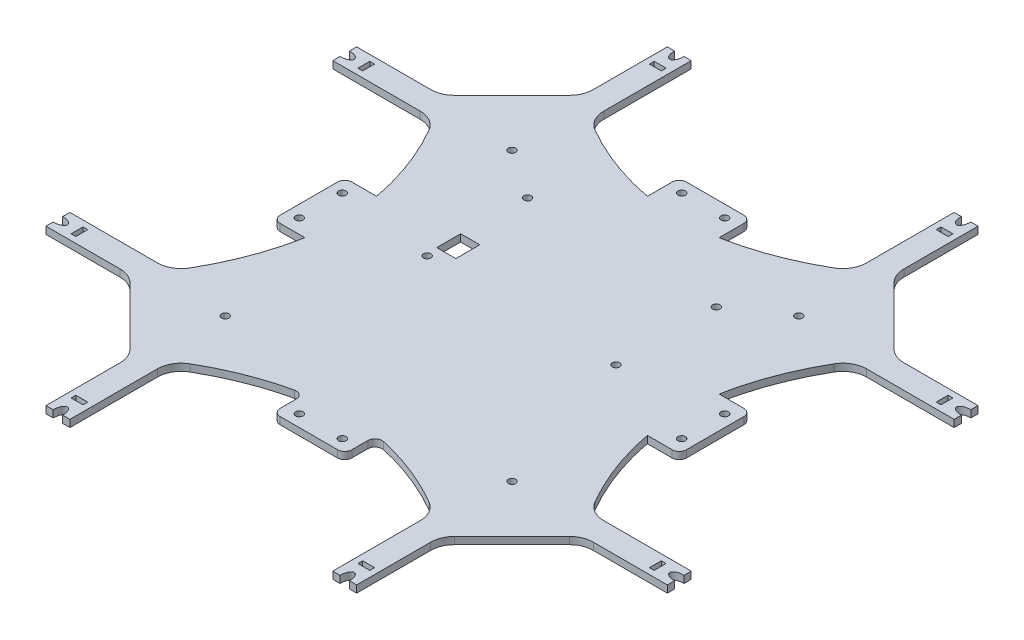
from build123d import *

# Parameters (mm, degrees)
SKETCH_1_R                   = 5
SKETCH_1_R_2                 = 1.55
EXTRUDE_1_DEPTH              = 3
SKETCH_2_R                   = 1.55
CUT_EXTRUDE_1_DEPTH          = 156.592416411
SKETCH_3_R                   = 1.55
CUT_EXTRUDE_2_DEPTH          = 156.592416411
SKETCH_4_W                   = 30
SKETCH_4_H                   = 30
SKETCH_4_R                   = 1.55
EXTRUDE_2_DEPTH              = 3
FILLET_1_R                   = 3
SKETCH_5_W                   = 2
SKETCH_5_H                   = 5
SKETCH_5_W_2                 = 5
SKETCH_5_H_2                 = 2
EXTRUDE_3_DEPTH              = 3
CUT_EXTRUDE_START            = -3
CUT_EXTRUDE_3_DEPTH          = 3
FILLET_4_R                   = 10
PATTERN_CIRCULAR_1_OUTLINE_R = 1.55
PATTERN_CIRCULAR_1_DEPTH     = 3
SKETCH_9_W                   = 8
SKETCH_9_H                   = 10
CUT_EXTRUDE_4_DEPTH          = 10


# Read off the part's stored shape, not the designer's step: 環狀複製排列1
with BuildPart() as part:
    # 草圖1 → 填料-伸長1 (new body)
    with BuildSketch(Plane(origin=(0, 0, 0), x_dir=(1, 0, 0), z_dir=(0, 1, 0))):
        with BuildLine():
            ThreePointArc((-75.988340656, 104.271419075), (-104.142135624, 104.142135624), (-104.271419075, 75.988340656))
            add(Edge.make_bspline(
                [(-104.271419075, 75.988340656), (-71.712668089, 41.311256225), (-70, 0)],
                knots=[0, 0, 0, 0.900052689, 0.900052689, 0.900052689], degree=2))
            add(Edge.make_bspline(
                [(-104.271419075, -75.988340656), (-71.712668089, -41.311256225), (-70, 0)],
                knots=[0, 0, 0, 0.900052689, 0.900052689, 0.900052689], degree=2))
            ThreePointArc((-104.271419075, -75.988340656), (-104.142135624, -104.142135624), (-75.988340656, -104.271419075))
            add(Edge.make_bspline(
                [(-75.988340656, -104.271419075), (-41.311256225, -71.712668089), (0, -70)],
                knots=[0, 0, 0, 0.900052689, 0.900052689, 0.900052689], degree=2))
            add(Edge.make_bspline(
                [(75.988340656, -104.271419075), (41.311256225, -71.712668089), (0, -70)],
                knots=[0, 0, 0, 0.900052689, 0.900052689, 0.900052689], degree=2))
            ThreePointArc((75.988340656, -104.271419075), (104.142135624, -104.142135624), (104.271419075, -75.988340656))
            add(Edge.make_bspline(
                [(104.271419075, -75.988340656), (71.712668089, -41.311256225), (70, 0)],
                knots=[0, 0, 0, 0.900052689, 0.900052689, 0.900052689], degree=2))
            add(Edge.make_bspline(
                [(104.271419075, 75.988340656), (71.712668089, 41.311256225), (70, 0)],
                knots=[0, 0, 0, 0.900052689, 0.900052689, 0.900052689], degree=2))
            ThreePointArc((104.271419075, 75.988340656), (104.142135624, 104.142135624), (75.988340656, 104.271419075))
            add(Edge.make_bspline(
                [(75.988340656, 104.271419075), (41.311256225, 71.712668089), (0, 70)],
                knots=[0, 0, 0, 0.900052689, 0.900052689, 0.900052689], degree=2))
            add(Edge.make_bspline(
                [(-75.988340656, 104.271419075), (-41.311256225, 71.712668089), (0, 70)],
                knots=[0, 0, 0, 0.900052689, 0.900052689, 0.900052689], degree=2))
        make_face()
        with Locations(Location((-90, 90, 0), (0, 0, 270))):
            Circle(SKETCH_1_R, mode=Mode.SUBTRACT)
        with Locations(Location((90, 90, 0), (0, 0, 270))):
            Circle(SKETCH_1_R, mode=Mode.SUBTRACT)
        with Locations(Location((90, -90, 0), (0, 0, 270))):
            Circle(SKETCH_1_R, mode=Mode.SUBTRACT)
        with Locations(Location((-90, -90, 0), (0, 0, 270))):
            Circle(SKETCH_1_R, mode=Mode.SUBTRACT)
        with Locations(Location((-90, 98, 0), (0, 0, 270))):
            Circle(SKETCH_1_R_2, mode=Mode.SUBTRACT)
        with Locations(Location((-99.5, 90, 0), (0, 0, 270))):
            Circle(SKETCH_1_R_2, mode=Mode.SUBTRACT)
        with Locations(Location((-90, 82, 0), (0, 0, 270))):
            Circle(SKETCH_1_R_2, mode=Mode.SUBTRACT)
        with Locations(Location((-80.5, 90, 0), (0, 0, 270))):
            Circle(SKETCH_1_R_2, mode=Mode.SUBTRACT)
        with Locations(Location((90, 98, 0), (0, 0, 270))):
            Circle(SKETCH_1_R_2, mode=Mode.SUBTRACT)
        with Locations(Location((90, 82, 0), (0, 0, 270))):
            Circle(SKETCH_1_R_2, mode=Mode.SUBTRACT)
        with Locations(Location((80.5, 90, 0), (0, 0, 270))):
            Circle(SKETCH_1_R_2, mode=Mode.SUBTRACT)
        with Locations(Location((99.5, 90, 0), (0, 0, 270))):
            Circle(SKETCH_1_R_2, mode=Mode.SUBTRACT)
        with Locations(Location((80.5, -90, 0), (0, 0, 270))):
            Circle(SKETCH_1_R_2, mode=Mode.SUBTRACT)
        with Locations(Location((90, -82, 0), (0, 0, 270))):
            Circle(SKETCH_1_R_2, mode=Mode.SUBTRACT)
        with Locations(Location((99.5, -90, 0), (0, 0, 270))):
            Circle(SKETCH_1_R_2, mode=Mode.SUBTRACT)
        with Locations(Location((90, -98, 0), (0, 0, 270))):
            Circle(SKETCH_1_R_2, mode=Mode.SUBTRACT)
        with Locations(Location((-90, -82, 0), (0, 0, 270))):
            Circle(SKETCH_1_R_2, mode=Mode.SUBTRACT)
        with Locations(Location((-80.5, -90, 0), (0, 0, 270))):
            Circle(SKETCH_1_R_2, mode=Mode.SUBTRACT)
        with Locations(Location((-90, -98, 0), (0, 0, 270))):
            Circle(SKETCH_1_R_2, mode=Mode.SUBTRACT)
        with Locations(Location((-99.5, -90, 0), (0, 0, 270))):
            Circle(SKETCH_1_R_2, mode=Mode.SUBTRACT)
    extrude(amount=EXTRUDE_1_DEPTH)

    # 草圖2 → 除料-伸長1 (cut, through all)
    with BuildSketch(Plane(origin=(0, 3, 0), x_dir=(1, 0, 0), z_dir=(0, 1, 0))):
        with Locations(Location((-60, 60, 0), (0, 0, 270))):
            Circle(SKETCH_2_R)
        with Locations(Location((60, 60, 0), (0, 0, 270))):
            Circle(SKETCH_2_R)
        with Locations(Location((60, -60, 0), (0, 0, 270))):
            Circle(SKETCH_2_R)
        with Locations(Location((-60, -60, 0), (0, 0, 270))):
            Circle(SKETCH_2_R)
    extrude(amount=-CUT_EXTRUDE_1_DEPTH, mode=Mode.SUBTRACT)

    # 草圖3 → 除料-伸長2 (cut, through all)
    with BuildSketch(Plane(origin=(0, 3, 0), x_dir=(1, 0, 0), z_dir=(0, 1, 0))):
        with Locations(Location((-39.5, 46, 0), (0, 0, 270))):
            Circle(SKETCH_3_R)
        with Locations(Location((39.5, 46, 0), (0, 0, 270))):
            Circle(SKETCH_3_R)
        with Locations(Location((39.5, 4, 0), (0, 0, 270))):
            Circle(SKETCH_3_R)
        with Locations(Location((-39.5, 4, 0), (0, 0, 270))):
            Circle(SKETCH_3_R)
    extrude(amount=-CUT_EXTRUDE_2_DEPTH, mode=Mode.SUBTRACT)

    # 草圖4 → 填料-伸長2 (add)
    with BuildSketch(Plane(origin=(0, 3, 0), x_dir=(1, 0, 0), z_dir=(0, 1, 0))):
        with Locations((0, -70)):
            Rectangle(SKETCH_4_W, SKETCH_4_H)
        with Locations(Location((-9, -80, 0), (0, 0, 270))):
            Circle(SKETCH_4_R, mode=Mode.SUBTRACT)
        with Locations(Location((9, -80, 0), (0, 0, 90))):
            Circle(SKETCH_4_R, mode=Mode.SUBTRACT)
    extrude(amount=-EXTRUDE_2_DEPTH)

    # 圓角1
    fillet_1_edges = [part.edges().sort_by_distance(p)[0] for p in [
        (-15, 1.5, 85),
        (15, 1.5, 71.678655516),
        (15, 1.5, 85),
        (-15, 1.5, 71.678655516),
    ]]
    fillet(fillet_1_edges, radius=FILLET_1_R)

    # 草圖5 → 填料-伸長3 (add)
    # profile 1 of 8: a face of its own
    with BuildSketch(Plane(origin=(0, 3, 0), x_dir=(1, 0, 0), z_dir=(0, 1, 0))):
        with BuildLine():
            Line((-130, 62), (-130, 65))
            Line((-130, 65), (-94.857822627, 65))
            add(Edge.make_bspline(
                [(-94.857822627, 65), (-91.022806975, 60.063382547), (-87.777195204, 55)],
                knots=[0, 0, 0, 1, 1, 1], degree=2))
            Line((-87.777195204, 55), (-130, 55))
            Line((-130, 55), (-130, 58))
            add(Edge.make_bspline(
                [(-130, 58), (-126, 58), (-126, 60), (-126, 62), (-130, 62)],
                knots=[4.71238898, 4.71238898, 4.71238898, 6.283185307, 6.283185307, 7.853981634, 7.853981634, 7.853981634], degree=2, weights=[1, 0.707106781, 1, 0.707106781, 1]))
        make_face()
        with Locations((-121, 60)):
            Rectangle(SKETCH_5_W, SKETCH_5_H, mode=Mode.SUBTRACT)
    # profile 2 of 8: a face of its own
    with BuildSketch(Plane(origin=(0, 3, 0), x_dir=(1, 0, 0), z_dir=(0, 1, 0))):
        with BuildLine():
            Line((-58, 130), (-55, 130))
            Line((-55, 130), (-55, 87.777195204))
            add(Edge.make_bspline(
                [(-65, 94.857822627), (-60.063382547, 91.022806975), (-55, 87.777195204)],
                knots=[0, 0, 0, 1, 1, 1], degree=2))
            Line((-65, 94.857822627), (-65, 130))
            Line((-65, 130), (-62, 130))
            add(Edge.make_bspline(
                [(-62, 130), (-62, 126), (-60, 126), (-58, 126), (-58, 130)],
                knots=[4.71238898, 4.71238898, 4.71238898, 6.283185307, 6.283185307, 7.853981634, 7.853981634, 7.853981634], degree=2, weights=[1, 0.707106781, 1, 0.707106781, 1]))
        make_face()
        with Locations((-60, 121)):
            Rectangle(SKETCH_5_W_2, SKETCH_5_H_2, mode=Mode.SUBTRACT)
    # profile 3 of 8: a face of its own
    with BuildSketch(Plane(origin=(0, 3, 0), x_dir=(1, 0, 0), z_dir=(0, 1, 0))):
        with BuildLine():
            Line((55, 130), (55, 87.777195204))
            add(Edge.make_bspline(
                [(65, 94.857822627), (60.063382547, 91.022806975), (55, 87.777195204)],
                knots=[0, 0, 0, 1, 1, 1], degree=2))
            Line((65, 94.857822627), (65, 130))
            Line((65, 130), (62, 130))
            add(Edge.make_bspline(
                [(58, 130), (58, 126), (60, 126), (62, 126), (62, 130)],
                knots=[4.71238898, 4.71238898, 4.71238898, 6.283185307, 6.283185307, 7.853981634, 7.853981634, 7.853981634], degree=2, weights=[1, 0.707106781, 1, 0.707106781, 1]))
            Line((58, 130), (55, 130))
        make_face()
        with Locations((60, 121)):
            Rectangle(SKETCH_5_W_2, SKETCH_5_H_2, mode=Mode.SUBTRACT)
    # profile 4 of 8: a face of its own
    with BuildSketch(Plane(origin=(0, 3, 0), x_dir=(1, 0, 0), z_dir=(0, 1, 0))):
        with BuildLine():
            Line((130, 62), (130, 65))
            Line((130, 65), (94.857822627, 65))
            add(Edge.make_bspline(
                [(94.857822627, 65), (91.022806975, 60.063382547), (87.777195204, 55)],
                knots=[0, 0, 0, 1, 1, 1], degree=2))
            Line((87.777195204, 55), (130, 55))
            Line((130, 55), (130, 58))
            add(Edge.make_bspline(
                [(130, 62), (126, 62), (126, 60), (126, 58), (130, 58)],
                knots=[4.71238898, 4.71238898, 4.71238898, 6.283185307, 6.283185307, 7.853981634, 7.853981634, 7.853981634], degree=2, weights=[1, 0.707106781, 1, 0.707106781, 1]))
        make_face()
        with Locations((121, 60)):
            Rectangle(SKETCH_5_W, SKETCH_5_H, mode=Mode.SUBTRACT)
    # profile 5 of 8: a face of its own
    with BuildSketch(Plane(origin=(0, 3, 0), x_dir=(1, 0, 0), z_dir=(0, 1, 0))):
        with BuildLine():
            Line((130, -65), (94.857822627, -65))
            add(Edge.make_bspline(
                [(94.857822627, -65), (91.022806975, -60.063382547), (87.777195204, -55)],
                knots=[0, 0, 0, 1, 1, 1], degree=2))
            Line((87.777195204, -55), (130, -55))
            Line((130, -55), (130, -58))
            add(Edge.make_bspline(
                [(130, -58), (126, -58), (126, -60), (126, -62), (130, -62)],
                knots=[4.71238898, 4.71238898, 4.71238898, 6.283185307, 6.283185307, 7.853981634, 7.853981634, 7.853981634], degree=2, weights=[1, 0.707106781, 1, 0.707106781, 1]))
            Line((130, -62), (130, -65))
        make_face()
        with Locations((121, -60)):
            Rectangle(SKETCH_5_W, SKETCH_5_H, mode=Mode.SUBTRACT)
    # profile 6 of 8: a face of its own
    with BuildSketch(Plane(origin=(0, 3, 0), x_dir=(1, 0, 0), z_dir=(0, 1, 0))):
        with BuildLine():
            Line((58, -130), (55, -130))
            Line((55, -130), (55, -87.777195204))
            add(Edge.make_bspline(
                [(65, -94.857822627), (60.063382547, -91.022806975), (55, -87.777195204)],
                knots=[0, 0, 0, 1, 1, 1], degree=2))
            Line((65, -94.857822627), (65, -130))
            Line((65, -130), (62, -130))
            add(Edge.make_bspline(
                [(62, -130), (62, -126), (60, -126), (58, -126), (58, -130)],
                knots=[4.71238898, 4.71238898, 4.71238898, 6.283185307, 6.283185307, 7.853981634, 7.853981634, 7.853981634], degree=2, weights=[1, 0.707106781, 1, 0.707106781, 1]))
        make_face()
        with Locations((60, -121)):
            Rectangle(SKETCH_5_W_2, SKETCH_5_H_2, mode=Mode.SUBTRACT)
    # profile 7 of 8: a face of its own
    with BuildSketch(Plane(origin=(0, 3, 0), x_dir=(1, 0, 0), z_dir=(0, 1, 0))):
        with BuildLine():
            Line((-55, -130), (-55, -87.777195204))
            add(Edge.make_bspline(
                [(-65, -94.857822627), (-60.063382547, -91.022806975), (-55, -87.777195204)],
                knots=[0, 0, 0, 1, 1, 1], degree=2))
            Line((-65, -94.857822627), (-65, -130))
            Line((-65, -130), (-62, -130))
            add(Edge.make_bspline(
                [(-58, -130), (-58, -126), (-60, -126), (-62, -126), (-62, -130)],
                knots=[4.71238898, 4.71238898, 4.71238898, 6.283185307, 6.283185307, 7.853981634, 7.853981634, 7.853981634], degree=2, weights=[1, 0.707106781, 1, 0.707106781, 1]))
            Line((-58, -130), (-55, -130))
        make_face()
        with Locations((-60, -121)):
            Rectangle(SKETCH_5_W_2, SKETCH_5_H_2, mode=Mode.SUBTRACT)
    # profile 8 of 8: a face of its own
    with BuildSketch(Plane(origin=(0, 3, 0), x_dir=(1, 0, 0), z_dir=(0, 1, 0))):
        with BuildLine():
            Line((-130, -62), (-130, -65))
            Line((-130, -65), (-94.857822627, -65))
            add(Edge.make_bspline(
                [(-94.857822627, -65), (-91.022806975, -60.063382547), (-87.777195204, -55)],
                knots=[0, 0, 0, 1, 1, 1], degree=2))
            Line((-87.777195204, -55), (-130, -55))
            Line((-130, -55), (-130, -58))
            add(Edge.make_bspline(
                [(-130, -62), (-126, -62), (-126, -60), (-126, -58), (-130, -58)],
                knots=[4.71238898, 4.71238898, 4.71238898, 6.283185307, 6.283185307, 7.853981634, 7.853981634, 7.853981634], degree=2, weights=[1, 0.707106781, 1, 0.707106781, 1]))
        make_face()
        with Locations((-121, -60)):
            Rectangle(SKETCH_5_W, SKETCH_5_H, mode=Mode.SUBTRACT)
    extrude(amount=-EXTRUDE_3_DEPTH)

    # 草圖6 → 除料-伸長3 (cut)
    with BuildSketch(Plane(origin=(0, 3, 0), x_dir=(1, 0, 0), z_dir=(0, 1, 0)).offset(CUT_EXTRUDE_START)):
        with BuildLine():
            Line((-94.857822627, 65), (-64.999999959, 94.857822595))
            add(Edge.make_bspline(
                [(-75.988340656, 104.271419075), (-70.575005667, 99.188770727), (-64.999999959, 94.857822595)],
                knots=[0, 0, 0, 1, 1, 1], degree=2))
            ThreePointArc((-75.988340656, 104.271419075), (-104.142135624, 104.142135624), (-104.271419075, 75.988340656))
            add(Edge.make_bspline(
                [(-104.271419075, 75.988340656), (-99.188770745, 70.575005686), (-94.857822627, 65)],
                knots=[0, 0, 0, 1, 1, 1], degree=2))
        make_face()
        with BuildLine():
            Line((65, 94.857822627), (94.857822627, 65))
            add(Edge.make_bspline(
                [(104.271419075, 75.988340656), (99.188770745, 70.575005686), (94.857822627, 65)],
                knots=[0, 0, 0, 1, 1, 1], degree=2))
            ThreePointArc((104.271419075, 75.988340656), (104.142135624, 104.142135624), (75.988340656, 104.271419075))
            add(Edge.make_bspline(
                [(75.988340656, 104.271419075), (70.575005686, 99.188770745), (65, 94.857822627)],
                knots=[0, 0, 0, 1, 1, 1], degree=2))
        make_face()
        with BuildLine():
            Line((-94.857822627, -65), (-65, -94.857822627))
            add(Edge.make_bspline(
                [(-75.988340656, -104.271419075), (-70.575005686, -99.188770745), (-65, -94.857822627)],
                knots=[0, 0, 0, 1, 1, 1], degree=2))
            ThreePointArc((-75.988340656, -104.271419075), (-104.142135624, -104.142135624), (-104.271419075, -75.988340656))
            add(Edge.make_bspline(
                [(-104.271419075, -75.988340656), (-99.188770745, -70.575005686), (-94.857822627, -65)],
                knots=[0, 0, 0, 1, 1, 1], degree=2))
        make_face()
        with BuildLine():
            Line((65, -94.857822627), (94.857822627, -65))
            add(Edge.make_bspline(
                [(104.271419075, -75.988340656), (99.188770745, -70.575005686), (94.857822627, -65)],
                knots=[0, 0, 0, 1, 1, 1], degree=2))
            ThreePointArc((104.271419075, -75.988340656), (104.142135624, -104.142135624), (75.988340656, -104.271419075))
            add(Edge.make_bspline(
                [(75.988340656, -104.271419075), (70.575005686, -99.188770745), (65, -94.857822627)],
                knots=[0, 0, 0, 1, 1, 1], degree=2))
        make_face()
    extrude(amount=CUT_EXTRUDE_3_DEPTH, mode=Mode.SUBTRACT)

    # 圓角4
    fillet_4_edges = [part.edges().sort_by_distance(p)[0] for p in [
        (55, 1.5, -87.777195204),
        (-55, 1.5, -87.777195204),
        (65, 1.5, -94.857822627),
        (87.777195204, 1.5, -55),
        (94.857822627, 1.5, -65),
        (87.777195204, 1.5, 55),
        (94.857822627, 1.5, 65),
        (65, 1.5, 94.857822627),
        (55, 1.5, 87.777195204),
        (-55, 1.5, 87.777195204),
        (-87.777195204, 1.5, 55),
        (-65, 1.5, 94.857822627),
        (-94.857822627, 1.5, 65),
        (-87.777195204, 1.5, -55),
        (-94.857822627, 1.5, -65),
        (-65, 1.5, -94.857822627),
    ]]
    fillet(fillet_4_edges, radius=FILLET_4_R)

    # 環狀複製排列1 outline → 環狀複製排列1 (add)
    # profile 1 of 3: a face of its own
    with BuildSketch(Plane(origin=(0, 0, 0), x_dir=(1, 0, 0), z_dir=(0, 1, 0))):
        with BuildLine():
            ThreePointArc((-12, 85), (-14.121320344, 84.121320344), (-15, 82))
            Line((-15, 82), (-15, 71.678655516))
            add(Edge.make_bspline(
                [(-15, 71.678655516), (-7.612639428, 70.315602231), (0, 70)],
                knots=[0.734195312, 0.734195312, 0.734195312, 0.900052689, 0.900052689, 0.900052689], degree=2))
            add(Edge.make_bspline(
                [(15, 71.678655516), (7.612639428, 70.315602231), (0, 70)],
                knots=[0.734195312, 0.734195312, 0.734195312, 0.900052689, 0.900052689, 0.900052689], degree=2))
            Line((15, 71.678655516), (15, 82))
            ThreePointArc((15, 82), (14.121320344, 84.121320344), (12, 85))
            Line((12, 85), (-12, 85))
        make_face()
        with Locations((-9, 80)):
            Circle(PATTERN_CIRCULAR_1_OUTLINE_R, mode=Mode.SUBTRACT)
        with Locations((9, 80)):
            Circle(PATTERN_CIRCULAR_1_OUTLINE_R, mode=Mode.SUBTRACT)
    # profile 2 of 3: a face of its own
    with BuildSketch(Plane(origin=(0, 0, 0), x_dir=(1, 0, 0), z_dir=(0, 1, 0))):
        with BuildLine():
            add(Edge.make_bspline(
                [(-71.678655516, 15), (-70.315602231, 7.612639428), (-70, 0)],
                knots=[0.734195312, 0.734195312, 0.734195312, 0.900052689, 0.900052689, 0.900052689], degree=2))
            Line((-71.678655516, 15), (-82, 15))
            ThreePointArc((-82, 15), (-84.121320344, 14.121320344), (-85, 12))
            Line((-85, 12), (-85, -12))
            ThreePointArc((-85, -12), (-84.121320344, -14.121320344), (-82, -15))
            Line((-82, -15), (-71.678655516, -15))
            add(Edge.make_bspline(
                [(-71.678655516, -15), (-70.315602231, -7.612639428), (-70, 0)],
                knots=[0.734195312, 0.734195312, 0.734195312, 0.900052689, 0.900052689, 0.900052689], degree=2))
        make_face()
        with Locations((-80, -9)):
            Circle(PATTERN_CIRCULAR_1_OUTLINE_R, mode=Mode.SUBTRACT)
        with Locations((-80, 9)):
            Circle(PATTERN_CIRCULAR_1_OUTLINE_R, mode=Mode.SUBTRACT)
    # profile 3 of 3: a face of its own
    with BuildSketch(Plane(origin=(0, 0, 0), x_dir=(1, 0, 0), z_dir=(0, 1, 0))):
        with BuildLine():
            ThreePointArc((85, 12), (84.121320344, 14.121320344), (82, 15))
            Line((82, 15), (71.678655516, 15))
            add(Edge.make_bspline(
                [(71.678655516, 15), (70.315602231, 7.612639428), (70, 0)],
                knots=[0.734195312, 0.734195312, 0.734195312, 0.900052689, 0.900052689, 0.900052689], degree=2))
            add(Edge.make_bspline(
                [(71.678655516, -15), (70.315602231, -7.612639428), (70, 0)],
                knots=[0.734195312, 0.734195312, 0.734195312, 0.900052689, 0.900052689, 0.900052689], degree=2))
            Line((71.678655516, -15), (82, -15))
            ThreePointArc((82, -15), (84.121320344, -14.121320344), (85, -12))
            Line((85, -12), (85, 12))
        make_face()
        with Locations((80, -9)):
            Circle(PATTERN_CIRCULAR_1_OUTLINE_R, mode=Mode.SUBTRACT)
        with Locations((80, 9)):
            Circle(PATTERN_CIRCULAR_1_OUTLINE_R, mode=Mode.SUBTRACT)
    extrude(amount=PATTERN_CIRCULAR_1_DEPTH)

    # 草圖9 → 除料-伸長4 (cut)
    with BuildSketch(Plane(origin=(0, 3, 0), x_dir=(1, 0, 0), z_dir=(0, 1, 0))):
        with Locations((-36.5, 14)):
            Rectangle(SKETCH_9_W, SKETCH_9_H)
    extrude(amount=-CUT_EXTRUDE_4_DEPTH, mode=Mode.SUBTRACT)


solid = part.part
